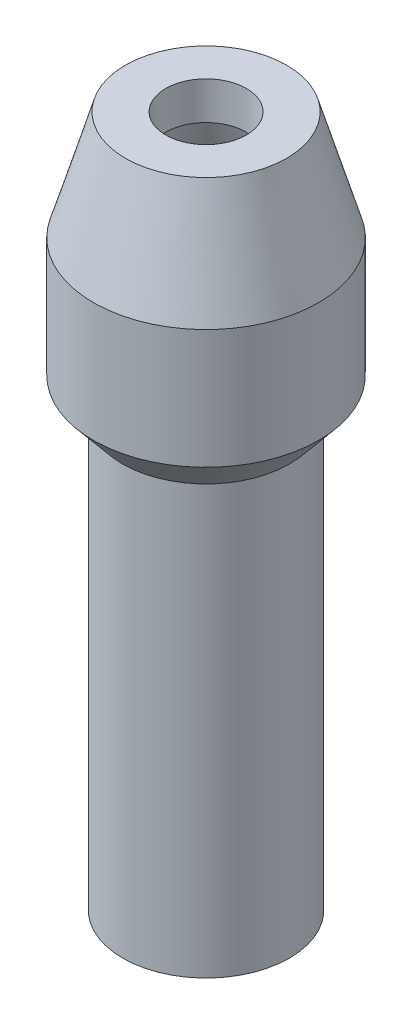
from build123d import *


with BuildPart() as part:
    # Sketch1 → Revolve1 (revolve)
    with BuildSketch(Plane.XY):
        Polygon((1.350818692, 8.1833977), (2.415818692, 8.1833977), (3.260818692, 5.304860745), (3.260818692, 2.154860745), (2.485818692, 1.22562719), (2.485818692, -10.07437281), (1.485818692, -10.07437281), (1.485818692, 1.587906474), (2.260818692, 2.517140029), (2.260818692, 5.161117497), (1.667174491, 7.1833977), (1.350818692, 7.1833977), align=None)
    revolve(axis=Axis((0.285818692, -10.07437281, 0), (0, 1, 0)))


solid = part.part
